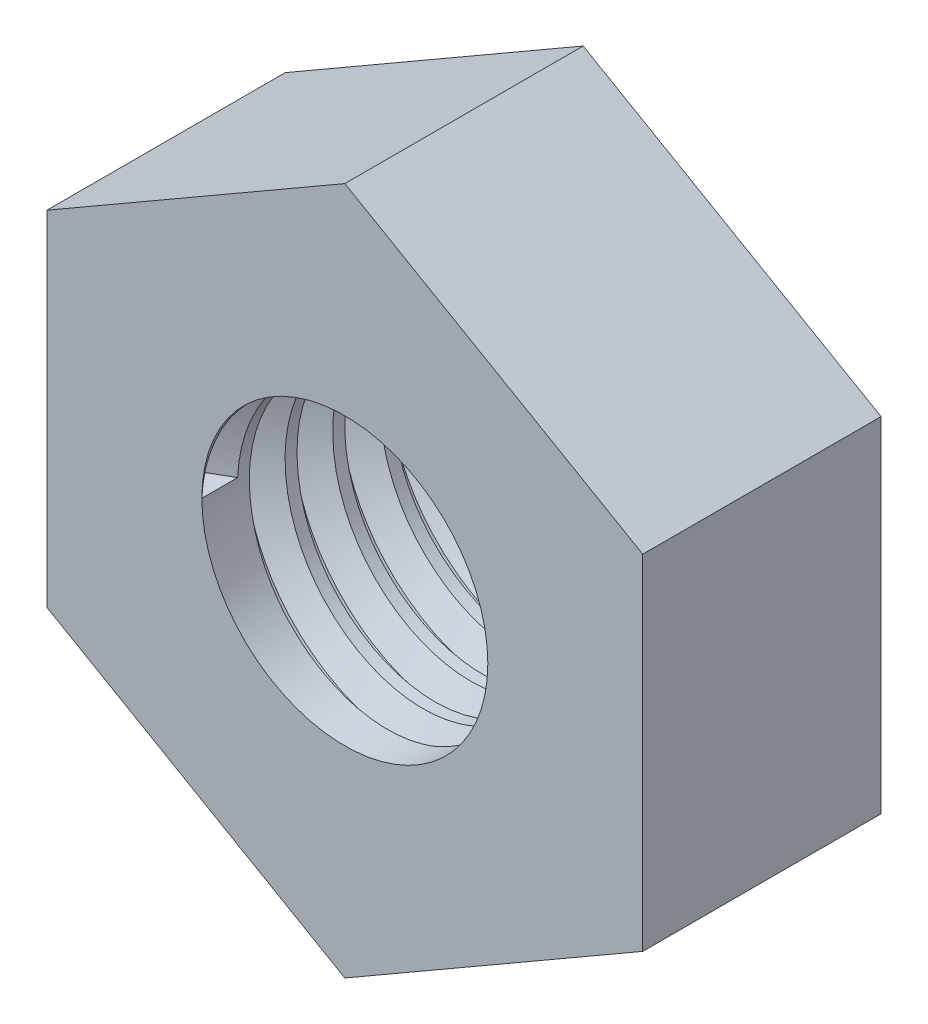
from build123d import *

# Parameters (mm, degrees)
SKETCH1_R           = 3
BOSS_EXTRUDE1_DEPTH = 5
THREAD1_PITCH       = 1


with BuildPart() as part:
    # Sketch1 → Boss-Extrude1 (new body)
    with BuildSketch(Plane.XY):
        Polygon((6.25, -3.608439182), (6.25, 3.608439182), (0, 7.216878365), (-6.25, 3.608439182), (-6.25, -3.608439182), (0, -7.216878365), align=None)
        Circle(SKETCH1_R, mode=Mode.SUBTRACT)
    extrude(amount=BOSS_EXTRUDE1_DEPTH)

    # Thread1: the profile of Thread Profile1 profile screwed along a right-hand helix of 5 turns, 8 arcs to a turn; built about Z, then put on its axis
    thread1_z = Axis((0, 0, 0), (0, 0, 1))
    thread1_corners = [(2.9997, 0, -0.000173205), (3.541265875, 0, 0.312499999), (3.541265875, 0, 0.437499999), (2.9997, 0, 0.750173202)]
    with BuildLine(mode=Mode.PRIVATE) as thread1_profile:
        Line(thread1_corners[0], thread1_corners[1])
        Line(thread1_corners[1], thread1_corners[2])
        Line(thread1_corners[2], thread1_corners[3])
        Line(thread1_corners[3], thread1_corners[0])
    thread1_cap = Face(thread1_profile.wire())
    thread1_turn_angles = [0, 22.5, 45, 67.5, 90, 112.5, 135, 157.5, 180, 202.5, 225, 247.5, 270, 292.5, 315, 337.5, 360]
    thread1_turn_weights = [1, 0.9238795325112867, 1, 0.9238795325112867, 1, 0.9238795325112867, 1, 0.9238795325112867, 1, 0.9238795325112867, 1, 0.9238795325112867, 1, 0.9238795325112867, 1, 0.9238795325112867, 1]
    thread1_turn_rails = [Edge.make_bspline([Vector(p[0], p[1], 0).rotate(thread1_z, thread1_turn_angles[k]) / thread1_turn_weights[k] + Vector(0, 0, p[2] + THREAD1_PITCH * thread1_turn_angles[k] / 360) for k in range(17)], [0, 0, 0, 1, 1, 2, 2, 3, 3, 4, 4, 5, 5, 6, 6, 7, 7, 8, 8, 8], 2, thread1_turn_weights) for p in thread1_corners]
    thread1_turn_sides = [Face.make_surface_from_curves(thread1_turn_rails[p[0]], thread1_turn_rails[p[1]]) for p in [(0, 1), (1, 2), (2, 3), (3, 0)]]
    thread1 = Plane(origin=(0, 0, 5), x_dir=(-1, 0, 0), z_dir=(0, 0, -1)) * Solid(Shell([*[p.moved(Location((0, 0, THREAD1_PITCH * i))) for i in range(5) for p in thread1_turn_sides], thread1_cap, thread1_cap.rotate(thread1_z, 1800).moved(Location((0, 0, THREAD1_PITCH * 1800 / 360)))]))
    add(thread1, mode=Mode.SUBTRACT)


solid = part.part
